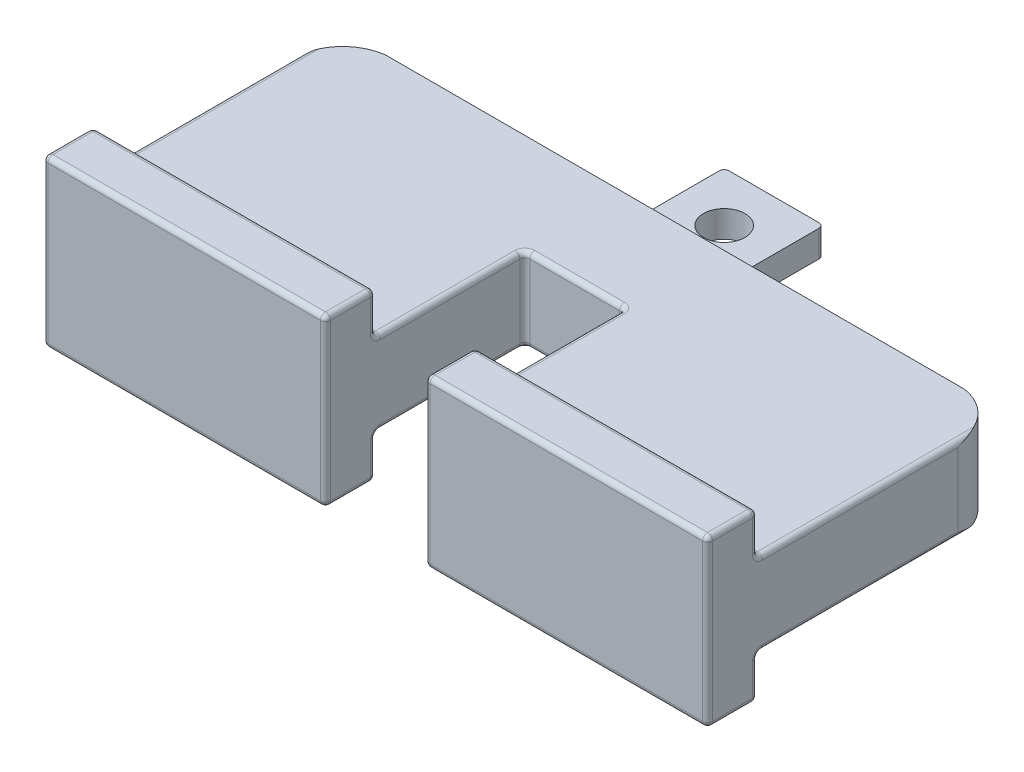
from build123d import *

# Parameters (mm, degrees)
ESQUISSE1_W                  = 6
ESQUISSE1_H                  = 1.6
BOSS_EXTRU_1_DEPTH           = 6
ESQUISSE2_R                  = 1.25
ENL_V_MAT_EXTRU_3_DEPTH      = 9.634813258
ESQUISSE5_W                  = 20
ESQUISSE5_H                  = 5
BOSS_EXTRU_2_DEPTH           = 18
ENL_V_MAT_EXTRU_4_DEPTH      = 30.776500802
ENL_V_MAT_EXTRU_4_DEPTH_BACK = 30.776500802
ESQUISSE6_W                  = 6
ESQUISSE6_H                  = 12
ESQUISSE8_W                  = 40
ESQUISSE8_H                  = 15
ENL_V_MAT_EXTRU_5_DEPTH      = 2.5
ESQUISSE9_W                  = 40
ESQUISSE9_H                  = 15
ENL_V_MAT_EXTRU_6_DEPTH      = 2.5
CONG_4_R                     = 0.3
ENL_V_START                  = -7.5
ENL_V_MAT_EXTRU_11_DEPTH     = 10
CONG_5_R                     = 0.3


with BuildPart() as part:
    # Esquisse1 → Boss.-Extru.1 (new body)
    with BuildSketch(Plane.XY):
        with Locations((3, 0.8)):
            Rectangle(ESQUISSE1_W, ESQUISSE1_H)
    extrude(amount=-BOSS_EXTRU_1_DEPTH)

    # Esquisse2 → Enlèv. mat.-Extru.3 (cut, through all)
    with BuildSketch(Plane(origin=(0, 0, 0), x_dir=(1, 0, 0), z_dir=(0, 1, 0))):
        with Locations(Location((3, 3, 0), (0, 0, 270))):
            Circle(ESQUISSE2_R)
    extrude(amount=ENL_V_MAT_EXTRU_3_DEPTH, mode=Mode.SUBTRACT)

    # Congé4
    cong_4_edges = [part.edges().sort_by_distance(p)[0] for p in [
        (6, 0.8, -6),
        (0, 0.8, -6),
    ]]
    fillet(cong_4_edges, radius=CONG_4_R)


with BuildPart() as body_2:
    # Esquisse5 → Boss.-Extru.2 (new body)
    with BuildSketch(Plane.XY):
        with Locations((-7, -1.7)):
            Rectangle(ESQUISSE5_W, ESQUISSE5_H)
        with Locations((-7, 3.3)):
            Rectangle(ESQUISSE5_W, ESQUISSE5_H)
        with Locations((13, -1.7)):
            Rectangle(ESQUISSE5_W, ESQUISSE5_H)
        with Locations((13, 3.3)):
            Rectangle(ESQUISSE5_W, ESQUISSE5_H)
    extrude(amount=BOSS_EXTRU_2_DEPTH)

    # Esquisse6 → Enlèv. mat.-Extru.4 (cut, two sides: drawn at the far end of the back side and taken through both)
    with BuildSketch(Plane(origin=(0, 0, 0), x_dir=(1, 0, 0), z_dir=(0, 1, 0)).offset(-ENL_V_MAT_EXTRU_4_DEPTH_BACK)):
        with Locations((3, -12)):
            Rectangle(ESQUISSE6_W, ESQUISSE6_H)
    extrude(amount=ENL_V_MAT_EXTRU_4_DEPTH + ENL_V_MAT_EXTRU_4_DEPTH_BACK, mode=Mode.SUBTRACT)

    # Esquisse8 → Enlèv. mat.-Extru.5 (cut)
    with BuildSketch(Plane(origin=(0, -4.2, 0), x_dir=(-1, 0, 0), z_dir=(0, -1, 0))):
        with Locations((-3, -7.5)):
            Rectangle(ESQUISSE8_W, ESQUISSE8_H)
    extrude(amount=-ENL_V_MAT_EXTRU_5_DEPTH, mode=Mode.SUBTRACT)

    # Esquisse9 → Enlèv. mat.-Extru.6 (cut)
    with BuildSketch(Plane(origin=(0, 5.8, 0), x_dir=(1, 0, 0), z_dir=(0, 1, 0))):
        with Locations((3, -7.5)):
            Rectangle(ESQUISSE9_W, ESQUISSE9_H)
    extrude(amount=-ENL_V_MAT_EXTRU_6_DEPTH, mode=Mode.SUBTRACT)

    # Enlèv. mat.-Extru.11: read off the stored shape, not the designer's step
    # Enlèv. mat.-Extru.11 outline → Enlèv. mat.-Extru.11 (cut)
    with BuildSketch(Plane(origin=(0, 3.3, 0), x_dir=(1, 0, 0), z_dir=(0, 1, 0)).offset(ENL_V_START)):
        with BuildLine():
            Line((23, 0), (20.481745596, 0))
            ThreePointArc((20.481745596, 0), (22.272827444, -1.002690515), (23, -2.922217157))
            Line((23, -2.922217157), (23, 0))
        make_face()
        with BuildLine():
            ThreePointArc((-17, -2.948636372), (-16.247183623, -0.986691509), (-14.391813039, 0))
            Line((-14.391813039, 0), (-17, 0))
            Line((-17, 0), (-17, -2.948636372))
        make_face()
    extrude(amount=ENL_V_MAT_EXTRU_11_DEPTH, mode=Mode.SUBTRACT)

    # Congé5
    # the kernel refuses this fillet: 0.3 mm, written as the material it adds along each edge
    with BuildSketch(Plane(origin=(6, -1.7, 6), x_dir=(0, 0, 1), z_dir=(0, 1, 0))) as cong_5_piece_1:
        with BuildLine():
            CenterArc((CONG_5_R, -CONG_5_R), CONG_5_R, 90, 90)
            Line((0, -CONG_5_R), (0, 0))
            Line((0, 0), (CONG_5_R, 0))
        make_face()
    extrude(amount=5)
    with BuildSketch(Plane(origin=(0, 3.3, 6), x_dir=(1, 0, 0), z_dir=(0, -1, 0))) as cong_5_piece_2:
        with BuildLine():
            CenterArc((CONG_5_R, CONG_5_R), CONG_5_R, 180, 90)
            Line((0, CONG_5_R), (0, 0))
            Line((0, 0), (CONG_5_R, 0))
        make_face()
    extrude(amount=5)
    with BuildSketch(Plane(origin=(0, -1.7, 15), x_dir=(0, 0, -1), z_dir=(-1, 0, 0))) as cong_5_piece_3:
        with BuildLine():
            CenterArc((CONG_5_R, CONG_5_R), CONG_5_R, 180, 90)
            Line((0, CONG_5_R), (0, 0))
            Line((0, 0), (CONG_5_R, 0))
        make_face()
    extrude(amount=17)
    with BuildSketch(Plane(origin=(23, -1.7, 15), x_dir=(0, -1, 0), z_dir=(-1, 0, 0)), Plane(origin=(0, 3.3, 15), x_dir=(0, 0, -1), z_dir=(-1, 0, 0)), Plane(origin=(23, 3.3, 15), x_dir=(0, 0, -1), z_dir=(-1, 0, 0))) as cong_5_piece_4:
        with BuildLine():
            CenterArc((CONG_5_R, -CONG_5_R), CONG_5_R, 90, 90)
            Line((0, -CONG_5_R), (0, 0))
            Line((0, 0), (CONG_5_R, 0))
        make_face()
    extrude(amount=17)
    # the kernel refuses this fillet: 0.3 mm, written as the material it takes off along each edge
    with BuildSketch(Plane(origin=(22.7, 5.5, 17.7), x_dir=(0, 0, 1), z_dir=(1, 0, 0))) as cong_5_2_piece_1_section:
        Polygon((0, 0), (CONG_5_R * 1.02, 0), (CONG_5_R * 1.02, -CONG_5_R * 1.02), (0, -CONG_5_R * 1.02), align=None)
    cong_5_2_piece_1 = extrude(amount=CONG_5_R * 1.02, mode=Mode.PRIVATE)
    cong_5_2_piece_1 = cong_5_2_piece_1 - Plane(origin=(22.7, 5.5, 17.7), x_dir=(0, -0.7071067811865475, -0.7071067811865475), z_dir=(1, 0, 0)) * Sphere(CONG_5_R, mode=Mode.PRIVATE)
    add(cong_5_2_piece_1, mode=Mode.SUBTRACT)
    with BuildSketch(Plane(origin=(22.7, -3.9, 17.7), x_dir=(1, 0, 0), z_dir=(0, -1, 0))) as cong_5_2_piece_2_section:
        Polygon((0, 0), (CONG_5_R * 1.02, 0), (CONG_5_R * 1.02, CONG_5_R * 1.02), (0, CONG_5_R * 1.02), align=None)
    cong_5_2_piece_2 = extrude(amount=CONG_5_R * 1.02, mode=Mode.PRIVATE)
    cong_5_2_piece_2 = cong_5_2_piece_2 - Plane(origin=(22.7, -3.9, 17.7), x_dir=(-0.7071067811865475, 0, -0.7071067811865475), z_dir=(0, -1, 0)) * Sphere(CONG_5_R, mode=Mode.PRIVATE)
    add(cong_5_2_piece_2, mode=Mode.SUBTRACT)
    with BuildSketch(Plane(origin=(-0.3, -3.9, 17.7), x_dir=(0, -1, 0), z_dir=(1, 0, 0))) as cong_5_2_piece_3_section:
        Polygon((0, 0), (CONG_5_R * 1.02, 0), (CONG_5_R * 1.02, -CONG_5_R * 1.02), (0, -CONG_5_R * 1.02), align=None)
    cong_5_2_piece_3 = extrude(amount=CONG_5_R * 1.02, mode=Mode.PRIVATE)
    cong_5_2_piece_3 = cong_5_2_piece_3 - Plane(origin=(-0.3, -3.9, 17.7), x_dir=(0, 0.7071067811865475, -0.7071067811865475), z_dir=(1, 0, 0)) * Sphere(CONG_5_R, mode=Mode.PRIVATE)
    add(cong_5_2_piece_3, mode=Mode.SUBTRACT)
    with BuildSketch(Plane(origin=(-16.7, -3.9, 17.7), x_dir=(0, -1, 0), z_dir=(-1, 0, 0))) as cong_5_2_piece_4_section:
        Polygon((0, 0), (CONG_5_R * 1.02, 0), (CONG_5_R * 1.02, CONG_5_R * 1.02), (0, CONG_5_R * 1.02), align=None)
    cong_5_2_piece_4 = extrude(amount=CONG_5_R * 1.02, mode=Mode.PRIVATE)
    cong_5_2_piece_4 = cong_5_2_piece_4 - Plane(origin=(-16.7, -3.9, 17.7), x_dir=(0, 0.7071067811865475, -0.7071067811865475), z_dir=(-1, 0, 0)) * Sphere(CONG_5_R, mode=Mode.PRIVATE)
    add(cong_5_2_piece_4, mode=Mode.SUBTRACT)
    with BuildSketch(Plane(origin=(6.3, -3.9, 17.7), x_dir=(0, 0, 1), z_dir=(0, -1, 0))) as cong_5_2_piece_5_section:
        Polygon((0, 0), (CONG_5_R * 1.02, 0), (CONG_5_R * 1.02, CONG_5_R * 1.02), (0, CONG_5_R * 1.02), align=None)
    cong_5_2_piece_5 = extrude(amount=CONG_5_R * 1.02, mode=Mode.PRIVATE)
    cong_5_2_piece_5 = cong_5_2_piece_5 - Plane(origin=(6.3, -3.9, 17.7), x_dir=(0.7071067811865475, 0, -0.7071067811865475), z_dir=(0, -1, 0)) * Sphere(CONG_5_R, mode=Mode.PRIVATE)
    add(cong_5_2_piece_5, mode=Mode.SUBTRACT)
    with BuildSketch(Plane(origin=(-0.3, 5.5, 17.7), x_dir=(1, 0, 0), z_dir=(0, 1, 0))) as cong_5_2_piece_6_section:
        Polygon((0, 0), (CONG_5_R * 1.02, 0), (CONG_5_R * 1.02, -CONG_5_R * 1.02), (0, -CONG_5_R * 1.02), align=None)
    cong_5_2_piece_6 = extrude(amount=CONG_5_R * 1.02, mode=Mode.PRIVATE)
    cong_5_2_piece_6 = cong_5_2_piece_6 - Plane(origin=(-0.3, 5.5, 17.7), x_dir=(-0.7071067811865475, 0, -0.7071067811865475), z_dir=(0, 1, 0)) * Sphere(CONG_5_R, mode=Mode.PRIVATE)
    add(cong_5_2_piece_6, mode=Mode.SUBTRACT)
    with BuildSketch(Plane(origin=(-16.7, 5.5, 17.7), x_dir=(-1, 0, 0), z_dir=(0, 1, 0))) as cong_5_2_piece_7_section:
        Polygon((0, 0), (CONG_5_R * 1.02, 0), (CONG_5_R * 1.02, CONG_5_R * 1.02), (0, CONG_5_R * 1.02), align=None)
    cong_5_2_piece_7 = extrude(amount=CONG_5_R * 1.02, mode=Mode.PRIVATE)
    cong_5_2_piece_7 = cong_5_2_piece_7 - Plane(origin=(-16.7, 5.5, 17.7), x_dir=(0.7071067811865475, 1.004859173557616e-15, -0.7071067811865475), z_dir=(0, 1, 0)) * Sphere(CONG_5_R, mode=Mode.PRIVATE)
    add(cong_5_2_piece_7, mode=Mode.SUBTRACT)
    with BuildSketch(Plane(origin=(6.3, 5.5, 17.7), x_dir=(0, 0, 1), z_dir=(0, 1, 0))) as cong_5_2_piece_8_section:
        Polygon((0, 0), (CONG_5_R * 1.02, 0), (CONG_5_R * 1.02, -CONG_5_R * 1.02), (0, -CONG_5_R * 1.02), align=None)
    cong_5_2_piece_8 = extrude(amount=CONG_5_R * 1.02, mode=Mode.PRIVATE)
    cong_5_2_piece_8 = cong_5_2_piece_8 - Plane(origin=(6.3, 5.5, 17.7), x_dir=(0.7071067811865475, 0, -0.7071067811865475), z_dir=(0, 1, 0)) * Sphere(CONG_5_R, mode=Mode.PRIVATE)
    add(cong_5_2_piece_8, mode=Mode.SUBTRACT)
    with BuildSketch(Plane(origin=(23, 5.8, 14.25), x_dir=(0, -1, 0), z_dir=(0, 0, 1)), Plane(origin=(23, -4.2, 14.25), x_dir=(-1, 0, 0), z_dir=(0, 0, 1)), Plane(origin=(-17, -4.2, 14.25), x_dir=(0, 1, 0), z_dir=(0, 0, 1)), Plane(origin=(6, 5.8, 17.7), x_dir=(0, -1, 0), z_dir=(0, 0, -1)), Plane(origin=(0, -4.2, 17.7), x_dir=(0, 1, 0), z_dir=(0, 0, -1)), Plane(origin=(0, 5.8, 14.25), x_dir=(0, -1, 0), z_dir=(0, 0, 1))) as cong_5_2_piece_9:
        with BuildLine():
            CenterArc((CONG_5_R, -CONG_5_R), CONG_5_R, 90, 90)
            Line((0, -CONG_5_R), (0, 0))
            Line((0, 0), (CONG_5_R, 0))
        make_face()
    extrude(amount=3.45, mode=Mode.SUBTRACT)
    with BuildSketch(Plane(origin=(23, -3.9, 18), x_dir=(0, 0, -1), z_dir=(0, 1, 0)), Plane(origin=(6, -3.9, 18), x_dir=(1, 0, 0), z_dir=(0, 1, 0))) as cong_5_2_piece_10:
        with BuildLine():
            CenterArc((CONG_5_R, CONG_5_R), CONG_5_R, 180, 90)
            Line((0, CONG_5_R), (0, 0))
            Line((0, 0), (CONG_5_R, 0))
        make_face()
    extrude(amount=9.4, mode=Mode.SUBTRACT)
    with BuildSketch(Plane(origin=(-0.3, -4.2, 18), x_dir=(0, 0, -1), z_dir=(-1, 0, 0)), Plane(origin=(22.7, -4.2, 18), x_dir=(0, 0, -1), z_dir=(-1, 0, 0)), Plane(origin=(-0.3, 5.8, 18), x_dir=(0, -1, 0), z_dir=(-1, 0, 0)), Plane(origin=(22.7, 5.8, 18), x_dir=(0, -1, 0), z_dir=(-1, 0, 0))) as cong_5_2_piece_11:
        with BuildLine():
            CenterArc((CONG_5_R, -CONG_5_R), CONG_5_R, 90, 90)
            Line((0, -CONG_5_R), (0, 0))
            Line((0, 0), (CONG_5_R, 0))
        make_face()
    extrude(amount=16.4, mode=Mode.SUBTRACT)
    with BuildSketch(Plane(origin=(0, 5.5, 18), x_dir=(0, 0, -1), z_dir=(0, -1, 0)), Plane(origin=(-17, -3.9, 18), x_dir=(0, 0, -1), z_dir=(0, 1, 0))) as cong_5_2_piece_12:
        with BuildLine():
            CenterArc((CONG_5_R, -CONG_5_R), CONG_5_R, 90, 90)
            Line((0, -CONG_5_R), (0, 0))
            Line((0, 0), (CONG_5_R, 0))
        make_face()
    extrude(amount=9.4, mode=Mode.SUBTRACT)
    with BuildSketch(Plane(origin=(6, -4.2, 14.25), x_dir=(1, 0, 0), z_dir=(0, 0, 1)), Plane(origin=(-17, 5.8, 14.25), x_dir=(0, -1, 0), z_dir=(0, 0, 1))) as cong_5_2_piece_13:
        with BuildLine():
            CenterArc((CONG_5_R, CONG_5_R), CONG_5_R, 180, 90)
            Line((0, CONG_5_R), (0, 0))
            Line((0, 0), (CONG_5_R, 0))
        make_face()
    extrude(amount=3.45, mode=Mode.SUBTRACT)
    with BuildSketch(Plane(origin=(0.75, -4.2, 15), x_dir=(0, 1, 0), z_dir=(-1, 0, 0)), Plane(origin=(0.75, 5.8, 15), x_dir=(0, 0, 1), z_dir=(-1, 0, 0))) as cong_5_2_piece_14:
        with BuildLine():
            CenterArc((CONG_5_R, -CONG_5_R), CONG_5_R, 90, 90)
            Line((0, -CONG_5_R), (0, 0))
            Line((0, 0), (CONG_5_R, 0))
        make_face()
    extrude(amount=18.5, mode=Mode.SUBTRACT)
    with BuildSketch(Plane(origin=(23.75, -4.2, 15), x_dir=(0, 0, 1), z_dir=(-1, 0, 0)), Plane(origin=(23.75, 5.8, 15), x_dir=(0, -1, 0), z_dir=(-1, 0, 0))) as cong_5_2_piece_15:
        with BuildLine():
            CenterArc((CONG_5_R, CONG_5_R), CONG_5_R, 180, 90)
            Line((0, CONG_5_R), (0, 0))
            Line((0, 0), (CONG_5_R, 0))
        make_face()
    extrude(amount=18.5, mode=Mode.SUBTRACT)
    # the kernel refuses this fillet: 0.3 mm, written as the material it takes off along each edge
    with BuildSketch(Plane(origin=(-16.7, 5.5, 15.3), x_dir=(0, 0, -1), z_dir=(-1, 0, 0))) as cong_5_3_piece_1_section:
        Polygon((0, 0), (CONG_5_R * 1.02, 0), (CONG_5_R * 1.02, -CONG_5_R * 1.02), (0, -CONG_5_R * 1.02), align=None)
    cong_5_3_piece_1 = extrude(amount=CONG_5_R * 1.02, mode=Mode.PRIVATE)
    cong_5_3_piece_1 = cong_5_3_piece_1 - Plane(origin=(-16.7, 5.5, 15.3), x_dir=(0, -0.7071067811865475, 0.7071067811865475), z_dir=(-1, 0, 0)) * Sphere(CONG_5_R, mode=Mode.PRIVATE)
    add(cong_5_3_piece_1, mode=Mode.SUBTRACT)
    with BuildSketch(Plane(origin=(22.7, 5.5, 15.3), x_dir=(0, 0, -1), z_dir=(1, 0, 0))) as cong_5_3_piece_2_section:
        Polygon((0, 0), (CONG_5_R * 1.02, 0), (CONG_5_R * 1.02, CONG_5_R * 1.02), (0, CONG_5_R * 1.02), align=None)
    cong_5_3_piece_2 = extrude(amount=CONG_5_R * 1.02, mode=Mode.PRIVATE)
    cong_5_3_piece_2 = cong_5_3_piece_2 - Plane(origin=(22.7, 5.5, 15.3), x_dir=(0, -0.7071067811865475, 0.7071067811865475), z_dir=(1, 0, 0)) * Sphere(CONG_5_R, mode=Mode.PRIVATE)
    add(cong_5_3_piece_2, mode=Mode.SUBTRACT)
    with BuildSketch(Plane(origin=(-0.3, 5.5, 15.3), x_dir=(0, 0, -1), z_dir=(1, 0, 0))) as cong_5_3_piece_3_section:
        Polygon((0, 0), (CONG_5_R * 1.02, 0), (CONG_5_R * 1.02, CONG_5_R * 1.02), (0, CONG_5_R * 1.02), align=None)
    cong_5_3_piece_3 = extrude(amount=CONG_5_R * 1.02, mode=Mode.PRIVATE)
    cong_5_3_piece_3 = cong_5_3_piece_3 - Plane(origin=(-0.3, 5.5, 15.3), x_dir=(0, -0.7071067811865475, 0.7071067811865475), z_dir=(1, 0, 0)) * Sphere(CONG_5_R, mode=Mode.PRIVATE)
    add(cong_5_3_piece_3, mode=Mode.SUBTRACT)
    with BuildSketch(Plane(origin=(6.3, 5.5, 15.3), x_dir=(0, 0, -1), z_dir=(-1, 0, 0))) as cong_5_3_piece_4_section:
        Polygon((0, 0), (CONG_5_R * 1.02, 0), (CONG_5_R * 1.02, -CONG_5_R * 1.02), (0, -CONG_5_R * 1.02), align=None)
    cong_5_3_piece_4 = extrude(amount=CONG_5_R * 1.02, mode=Mode.PRIVATE)
    cong_5_3_piece_4 = cong_5_3_piece_4 - Plane(origin=(6.3, 5.5, 15.3), x_dir=(0, -0.7071067811865475, 0.7071067811865475), z_dir=(-1, 0, 0)) * Sphere(CONG_5_R, mode=Mode.PRIVATE)
    add(cong_5_3_piece_4, mode=Mode.SUBTRACT)
    with BuildSketch(Plane(origin=(22.7, -3.9, 15.3), x_dir=(1, 0, 0), z_dir=(0, 0, -1))) as cong_5_3_piece_5_section:
        Polygon((0, 0), (CONG_5_R * 1.02, 0), (CONG_5_R * 1.02, CONG_5_R * 1.02), (0, CONG_5_R * 1.02), align=None)
    cong_5_3_piece_5 = extrude(amount=CONG_5_R * 1.02, mode=Mode.PRIVATE)
    cong_5_3_piece_5 = cong_5_3_piece_5 - Plane(origin=(22.7, -3.9, 15.3), x_dir=(-0.7071067811865475, 0.7071067811865475, 0), z_dir=(0, 0, -1)) * Sphere(CONG_5_R, mode=Mode.PRIVATE)
    add(cong_5_3_piece_5, mode=Mode.SUBTRACT)
    with BuildSketch(Plane(origin=(-16.7, -3.9, 15.3), x_dir=(0, 0, -1), z_dir=(-1, 0, 0))) as cong_5_3_piece_6_section:
        Polygon((0, 0), (CONG_5_R * 1.02, 0), (CONG_5_R * 1.02, CONG_5_R * 1.02), (0, CONG_5_R * 1.02), align=None)
    cong_5_3_piece_6 = extrude(amount=CONG_5_R * 1.02, mode=Mode.PRIVATE)
    cong_5_3_piece_6 = cong_5_3_piece_6 - Plane(origin=(-16.7, -3.9, 15.3), x_dir=(0, 0.7071067811865475, 0.7071067811865475), z_dir=(-1, 0, 0)) * Sphere(CONG_5_R, mode=Mode.PRIVATE)
    add(cong_5_3_piece_6, mode=Mode.SUBTRACT)
    with BuildSketch(Plane(origin=(-0.3, -3.9, 15.3), x_dir=(0, 0, -1), z_dir=(1, 0, 0))) as cong_5_3_piece_7_section:
        Polygon((0, 0), (CONG_5_R * 1.02, 0), (CONG_5_R * 1.02, -CONG_5_R * 1.02), (0, -CONG_5_R * 1.02), align=None)
    cong_5_3_piece_7 = extrude(amount=CONG_5_R * 1.02, mode=Mode.PRIVATE)
    cong_5_3_piece_7 = cong_5_3_piece_7 - Plane(origin=(-0.3, -3.9, 15.3), x_dir=(0, 0.7071067811865475, 0.7071067811865475), z_dir=(1, 0, 0)) * Sphere(CONG_5_R, mode=Mode.PRIVATE)
    add(cong_5_3_piece_7, mode=Mode.SUBTRACT)
    with BuildSketch(Plane(origin=(6.3, -3.9, 15.3), x_dir=(0, 0, -1), z_dir=(-1, 0, 0))) as cong_5_3_piece_8_section:
        Polygon((0, 0), (CONG_5_R * 1.02, 0), (CONG_5_R * 1.02, CONG_5_R * 1.02), (0, CONG_5_R * 1.02), align=None)
    cong_5_3_piece_8 = extrude(amount=CONG_5_R * 1.02, mode=Mode.PRIVATE)
    cong_5_3_piece_8 = cong_5_3_piece_8 - Plane(origin=(6.3, -3.9, 15.3), x_dir=(0, 0.7071067811865475, 0.7071067811865475), z_dir=(-1, 0, 0)) * Sphere(CONG_5_R, mode=Mode.PRIVATE)
    add(cong_5_3_piece_8, mode=Mode.SUBTRACT)
    with BuildSketch(Plane(origin=(0, 3.3, 14.7), x_dir=(-1, 0, 0), z_dir=(0, 0, -1)), Plane(origin=(6, -1.7, 6.3), x_dir=(0, 1, 0), z_dir=(0, 0, 1))) as cong_5_3_piece_9:
        with BuildLine():
            CenterArc((CONG_5_R, -CONG_5_R), CONG_5_R, 90, 90)
            Line((0, -CONG_5_R), (0, 0))
            Line((0, 0), (CONG_5_R, 0))
        make_face()
    extrude(amount=8.4, mode=Mode.SUBTRACT)
    with BuildSketch(Plane(origin=(0.3, 3.3, 6), x_dir=(0, 0, -1), z_dir=(1, 0, 0))) as cong_5_3_piece_10:
        with BuildLine():
            CenterArc((CONG_5_R, -CONG_5_R), CONG_5_R, 90, 90)
            Line((0, -CONG_5_R), (0, 0))
            Line((0, 0), (CONG_5_R, 0))
        make_face()
    extrude(amount=5.4, mode=Mode.SUBTRACT)
    with BuildSketch(Plane(origin=(-17, 3.3, 14.7), x_dir=(1, 0, 0), z_dir=(0, 0, -1))) as cong_5_3_piece_11:
        with BuildLine():
            CenterArc((CONG_5_R, CONG_5_R), CONG_5_R, 180, 90)
            Line((0, CONG_5_R), (0, 0))
            Line((0, 0), (CONG_5_R, 0))
        make_face()
    extrude(amount=14.001363628, mode=Mode.SUBTRACT)
    with BuildSketch(Plane(origin=(23, -1.7, 1.647217157), x_dir=(0, 1, 0), z_dir=(0, 0, 1))) as cong_5_3_piece_12:
        with BuildLine():
            CenterArc((CONG_5_R, CONG_5_R), CONG_5_R, 180, 90)
            Line((0, CONG_5_R), (0, 0))
            Line((0, 0), (CONG_5_R, 0))
        make_face()
    extrude(amount=13.052782843, mode=Mode.SUBTRACT)
    with BuildSketch(Plane(origin=(6, -3.9, 15), x_dir=(0, 0, 1), z_dir=(0, 1, 0)), Plane(origin=(0, -2, 15), x_dir=(0, 0, 1), z_dir=(0, -1, 0)), Plane(origin=(-17, -3.9, 15), x_dir=(0, 0, 1), z_dir=(0, 1, 0)), Plane(origin=(23, -3.9, 15), x_dir=(-1, 0, 0), z_dir=(0, 1, 0)), Plane(origin=(23, 5.5, 15), x_dir=(0, 0, 1), z_dir=(0, -1, 0))) as cong_5_3_piece_13:
        with BuildLine():
            CenterArc((CONG_5_R, CONG_5_R), CONG_5_R, 180, 90)
            Line((0, CONG_5_R), (0, 0))
            Line((0, 0), (CONG_5_R, 0))
        make_face()
    extrude(amount=1.9, mode=Mode.SUBTRACT)
    with BuildSketch(Plane(origin=(0, -1.7, 14.7), x_dir=(-1, 0, 0), z_dir=(0, 0, -1)), Plane(origin=(6, 3.3, 6.3), x_dir=(0, -1, 0), z_dir=(0, 0, 1))) as cong_5_3_piece_14:
        with BuildLine():
            CenterArc((CONG_5_R, CONG_5_R), CONG_5_R, 180, 90)
            Line((0, CONG_5_R), (0, 0))
            Line((0, 0), (CONG_5_R, 0))
        make_face()
    extrude(amount=8.4, mode=Mode.SUBTRACT)
    with BuildSketch(Plane(origin=(0.3, -1.7, 6), x_dir=(0, 0, -1), z_dir=(1, 0, 0))) as cong_5_3_piece_15:
        with BuildLine():
            CenterArc((CONG_5_R, CONG_5_R), CONG_5_R, 180, 90)
            Line((0, CONG_5_R), (0, 0))
            Line((0, 0), (CONG_5_R, 0))
        make_face()
    extrude(amount=5.4, mode=Mode.SUBTRACT)
    with BuildSketch(Plane(origin=(-17, -1.7, 14.7), x_dir=(1, 0, 0), z_dir=(0, 0, -1))) as cong_5_3_piece_16:
        with BuildLine():
            CenterArc((CONG_5_R, -CONG_5_R), CONG_5_R, 90, 90)
            Line((0, -CONG_5_R), (0, 0))
            Line((0, 0), (CONG_5_R, 0))
        make_face()
    extrude(amount=14.001363628, mode=Mode.SUBTRACT)
    with BuildSketch(Plane(origin=(6, 5.5, 15), x_dir=(0, 0, 1), z_dir=(0, -1, 0)), Plane(origin=(0, 3.6, 15), x_dir=(0, 0, 1), z_dir=(0, 1, 0)), Plane(origin=(-17, 5.5, 15), x_dir=(0, 0, 1), z_dir=(0, -1, 0))) as cong_5_3_piece_17:
        with BuildLine():
            CenterArc((CONG_5_R, -CONG_5_R), CONG_5_R, 90, 90)
            Line((0, -CONG_5_R), (0, 0))
            Line((0, 0), (CONG_5_R, 0))
        make_face()
    extrude(amount=1.9, mode=Mode.SUBTRACT)
    with BuildSketch(Plane(origin=(23, 3.3, 1.647217157), x_dir=(0, -1, 0), z_dir=(0, 0, 1))) as cong_5_3_piece_18:
        with BuildLine():
            CenterArc((CONG_5_R, -CONG_5_R), CONG_5_R, 90, 90)
            Line((0, -CONG_5_R), (0, 0))
            Line((0, 0), (CONG_5_R, 0))
        make_face()
    extrude(amount=13.052782843, mode=Mode.SUBTRACT)
    with BuildSketch(Plane(origin=(23, 3.6, 14.7), x_dir=(0, -1, 0), z_dir=(0, 0, -1))) as cong_5_3_piece_19:
        with BuildLine():
            CenterArc((0.3 + CONG_5_R, CONG_5_R), CONG_5_R, 180, 90)
            Line((0.3, CONG_5_R), (0.3, 0))
            Line((0.3, 0), (0.3 + CONG_5_R, 0))
        make_face()
    revolve(axis=Axis((23, 3.6, 14.7), (-1, 0, 0)), revolution_arc=90, mode=Mode.SUBTRACT)
    with BuildSketch(Plane(origin=(-17, 3.6, 14.7), x_dir=(0, -1, 0), z_dir=(0, 0, -1))) as cong_5_3_piece_20:
        with BuildLine():
            CenterArc((0.3 + CONG_5_R, -CONG_5_R), CONG_5_R, 90, 90)
            Line((0.3, -CONG_5_R), (0.3, 0))
            Line((0.3, 0), (0.3 + CONG_5_R, 0))
        make_face()
    revolve(axis=Axis((-17, 3.6, 14.7), (-1, 0, 0)), revolution_arc=90, mode=Mode.SUBTRACT)
    with BuildSketch(Plane(origin=(0, 3.6, 14.7), x_dir=(0, -1, 0), z_dir=(0, 0, -1))) as cong_5_3_piece_21:
        with BuildLine():
            CenterArc((0.3 + CONG_5_R, CONG_5_R), CONG_5_R, 180, 90)
            Line((0.3, CONG_5_R), (0.3, 0))
            Line((0.3, 0), (0.3 + CONG_5_R, 0))
        make_face()
    revolve(axis=Axis((0, 3.6, 14.7), (-1, 0, 0)), revolution_arc=90, mode=Mode.SUBTRACT)
    with BuildSketch(Plane(origin=(6, 3.6, 14.7), x_dir=(0, -1, 0), z_dir=(0, 0, -1))) as cong_5_3_piece_22:
        with BuildLine():
            CenterArc((0.3 + CONG_5_R, -CONG_5_R), CONG_5_R, 90, 90)
            Line((0.3, -CONG_5_R), (0.3, 0))
            Line((0.3, 0), (0.3 + CONG_5_R, 0))
        make_face()
    revolve(axis=Axis((6, 3.6, 14.7), (-1, 0, 0)), revolution_arc=90, mode=Mode.SUBTRACT)
    with BuildSketch(Plane(origin=(5.7, 3.3, 6.3), x_dir=(1, 0, 0), z_dir=(0, 0, 1))) as cong_5_3_piece_23:
        with BuildLine():
            CenterArc((0.3 + CONG_5_R, -CONG_5_R), CONG_5_R, 90, 90)
            Line((0.3 + CONG_5_R, 0), (0.3, 0))
            Line((0.3, 0), (0.3, -CONG_5_R))
        make_face()
    revolve(axis=Axis((5.7, 3.3, 6.3), (0, 1, 0)), revolution_arc=90, mode=Mode.SUBTRACT)
    with BuildSketch(Plane(origin=(23, -2, 14.7), x_dir=(0, 0, 1), z_dir=(0, -1, 0))) as cong_5_3_piece_24:
        with BuildLine():
            CenterArc((0.3 + CONG_5_R, CONG_5_R), CONG_5_R, 180, 90)
            Line((0.3, CONG_5_R), (0.3, 0))
            Line((0.3, 0), (0.3 + CONG_5_R, 0))
        make_face()
    revolve(axis=Axis((23, -2, 14.7), (-1, 0, 0)), revolution_arc=90, mode=Mode.SUBTRACT)
    with BuildSketch(Plane(origin=(-17, -2, 14.7), x_dir=(0, 1, 0), z_dir=(0, 0, -1))) as cong_5_3_piece_25:
        with BuildLine():
            CenterArc((0.3 + CONG_5_R, CONG_5_R), CONG_5_R, 180, 90)
            Line((0.3 + CONG_5_R, 0), (0.3, 0))
            Line((0.3, 0), (0.3, CONG_5_R))
        make_face()
    revolve(axis=Axis((-17, -2, 14.7), (1, 0, 0)), revolution_arc=90, mode=Mode.SUBTRACT)
    with BuildSketch(Plane(origin=(0.3, -1.7, 6.3), x_dir=(0, 0, -1), z_dir=(1, 0, 0))) as cong_5_3_piece_26:
        with BuildLine():
            CenterArc((0.3 + CONG_5_R, CONG_5_R), CONG_5_R, 180, 90)
            Line((0.3, CONG_5_R), (0.3, 0))
            Line((0.3, 0), (0.3 + CONG_5_R, 0))
        make_face()
    revolve(axis=Axis((0.3, -1.7, 6.3), (0, 1, 0)), revolution_arc=90, mode=Mode.SUBTRACT)
    with BuildSketch(Plane(origin=(5.7, -1.7, 6.3), x_dir=(1, 0, 0), z_dir=(0, 0, 1))) as cong_5_3_piece_27:
        with BuildLine():
            CenterArc((0.3 + CONG_5_R, CONG_5_R), CONG_5_R, 180, 90)
            Line((0.3, CONG_5_R), (0.3, 0))
            Line((0.3, 0), (0.3 + CONG_5_R, 0))
        make_face()
    revolve(axis=Axis((5.7, -1.7, 6.3), (0, 1, 0)), revolution_arc=90, mode=Mode.SUBTRACT)
    with BuildSketch(Plane(origin=(0, -2, 14.7), x_dir=(0, 1, 0), z_dir=(0, 0, -1))) as cong_5_3_piece_28:
        with BuildLine():
            CenterArc((0.3 + CONG_5_R, -CONG_5_R), CONG_5_R, 90, 90)
            Line((0.3, -CONG_5_R), (0.3, 0))
            Line((0.3, 0), (0.3 + CONG_5_R, 0))
        make_face()
    revolve(axis=Axis((0, -2, 14.7), (1, 0, 0)), revolution_arc=90, mode=Mode.SUBTRACT)
    with BuildSketch(Plane(origin=(6, -2, 14.7), x_dir=(0, 0, 1), z_dir=(0, -1, 0))) as cong_5_3_piece_29:
        with BuildLine():
            CenterArc((0.3 + CONG_5_R, -CONG_5_R), CONG_5_R, 90, 90)
            Line((0.3, -CONG_5_R), (0.3, 0))
            Line((0.3, 0), (0.3 + CONG_5_R, 0))
        make_face()
    revolve(axis=Axis((6, -2, 14.7), (-1, 0, 0)), revolution_arc=90, mode=Mode.SUBTRACT)
    with BuildSketch(Plane(origin=(0.3, 3.3, 6.3), x_dir=(0, 0, -1), z_dir=(1, 0, 0))) as cong_5_3_piece_30:
        with BuildLine():
            CenterArc((0.3 + CONG_5_R, -CONG_5_R), CONG_5_R, 90, 90)
            Line((0.3, -CONG_5_R), (0.3, 0))
            Line((0.3, 0), (0.3 + CONG_5_R, 0))
        make_face()
    revolve(axis=Axis((0.3, 3.3, 6.3), (0, 1, 0)), revolution_arc=90, mode=Mode.SUBTRACT)


solid = Compound([part.part, body_2.part])
